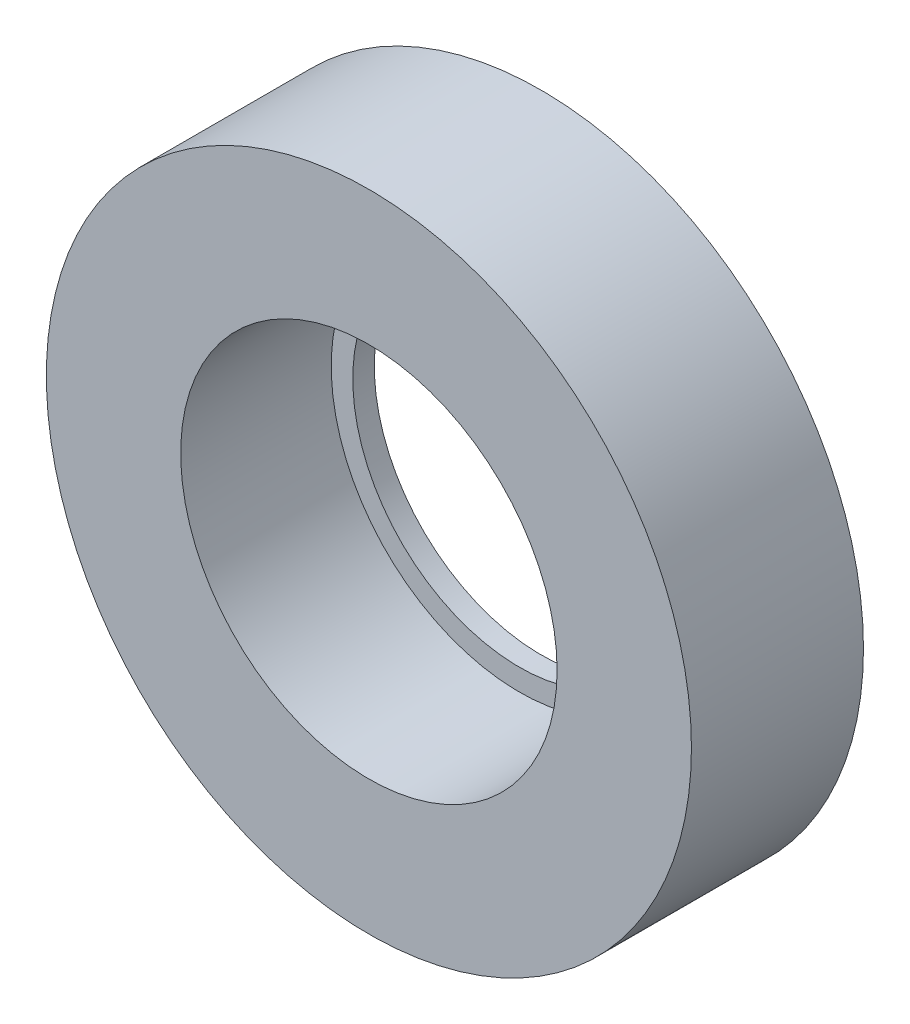
from build123d import *

# Parameters (mm, degrees)
SKETCH1_R           = 30
BOSS_EXTRUDE1_DEPTH = 16
SKETCH2_R           = 17.505
CUT_EXTRUDE1_DEPTH  = 14
SKETCH4_R           = 15.5
CUT_EXTRUDE2_DEPTH  = 45.676615807


with BuildPart() as part:
    # Sketch1 → Boss-Extrude1 (new body)
    with BuildSketch(Plane.XY):
        Circle(SKETCH1_R)
    extrude(amount=BOSS_EXTRUDE1_DEPTH)

    # Sketch2 → Cut-Extrude1 (cut)
    with BuildSketch(Plane.XY.offset(16)):
        Circle(SKETCH2_R)
    extrude(amount=-CUT_EXTRUDE1_DEPTH, mode=Mode.SUBTRACT)

    # Sketch4 → Cut-Extrude2 (cut, through all)
    with BuildSketch(Plane.XY.offset(2)):
        Circle(SKETCH4_R)
    extrude(amount=-CUT_EXTRUDE2_DEPTH, mode=Mode.SUBTRACT)


solid = part.part
